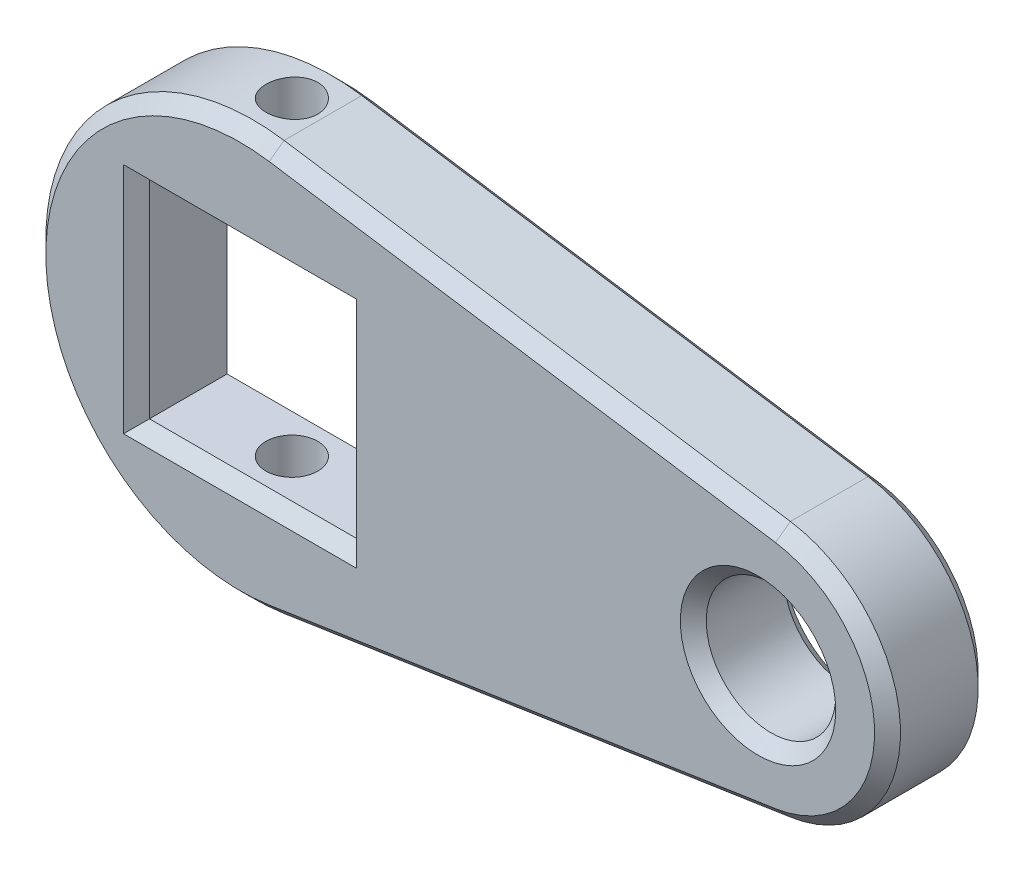
from build123d import *

# Parameters (mm, degrees)
SKETCH_1_R          = 2.5
SKETCH_1_W          = 8
SKETCH_1_H          = 8
EXTRUDE_1_DEPTH     = 2
SKETCH_2_R          = 1
CUT_EXTRUDE_1_DEPTH = 22
CHAMFER_1_SIZE      = 0.5


with BuildPart() as part:
    # 草图1 → 凸台-拉伸1 (new, symmetric)
    with BuildSketch(Plane.XY):
        with BuildLine():
            Line((1.2, 7.909487973), (20.75, 4.943429983))
            ThreePointArc((20.75, 4.943429983), (25, 0), (20.75, -4.943429983))
            Line((20.75, -4.943429983), (1.2, -7.909487973))
            ThreePointArc((1.2, -7.909487973), (-8, 0), (1.2, 7.909487973))
        make_face()
        with Locations((20, 0)):
            Circle(SKETCH_1_R, mode=Mode.SUBTRACT)
        Rectangle(SKETCH_1_W, SKETCH_1_H, mode=Mode.SUBTRACT)
    extrude(amount=EXTRUDE_1_DEPTH, both=True)

    # 草图2 → 切除-拉伸1 (cut, symmetric)
    with BuildSketch(Plane(origin=(0, 0, 0), x_dir=(1, 0, 0), z_dir=(0, 1, 0))):
        Circle(SKETCH_2_R)
    extrude(amount=CUT_EXTRUDE_1_DEPTH, both=True, mode=Mode.SUBTRACT)

    # 倒角1
    chamfer_1_edges = [part.edges().sort_by_distance(p)[0] for p in [
        (17.5, 0, -2),
        (0, 4, -2),
        (4, 0, -2),
        (0, -4, -2),
        (-4, 0, -2),
        (10.975, 6.426458978, -2),
        (-8, 0, -2),
        (10.975, -6.426458978, -2),
        (25, 0, -2),
        (17.5, 0, 2),
        (10.975, -6.426458978, 2),
        (-8, 0, 2),
        (10.975, 6.426458978, 2),
        (25, 0, 2),
        (4, 0, 2),
        (0, 4, 2),
        (-4, 0, 2),
        (0, -4, 2),
    ]]
    chamfer(chamfer_1_edges, length=CHAMFER_1_SIZE)


solid = part.part
